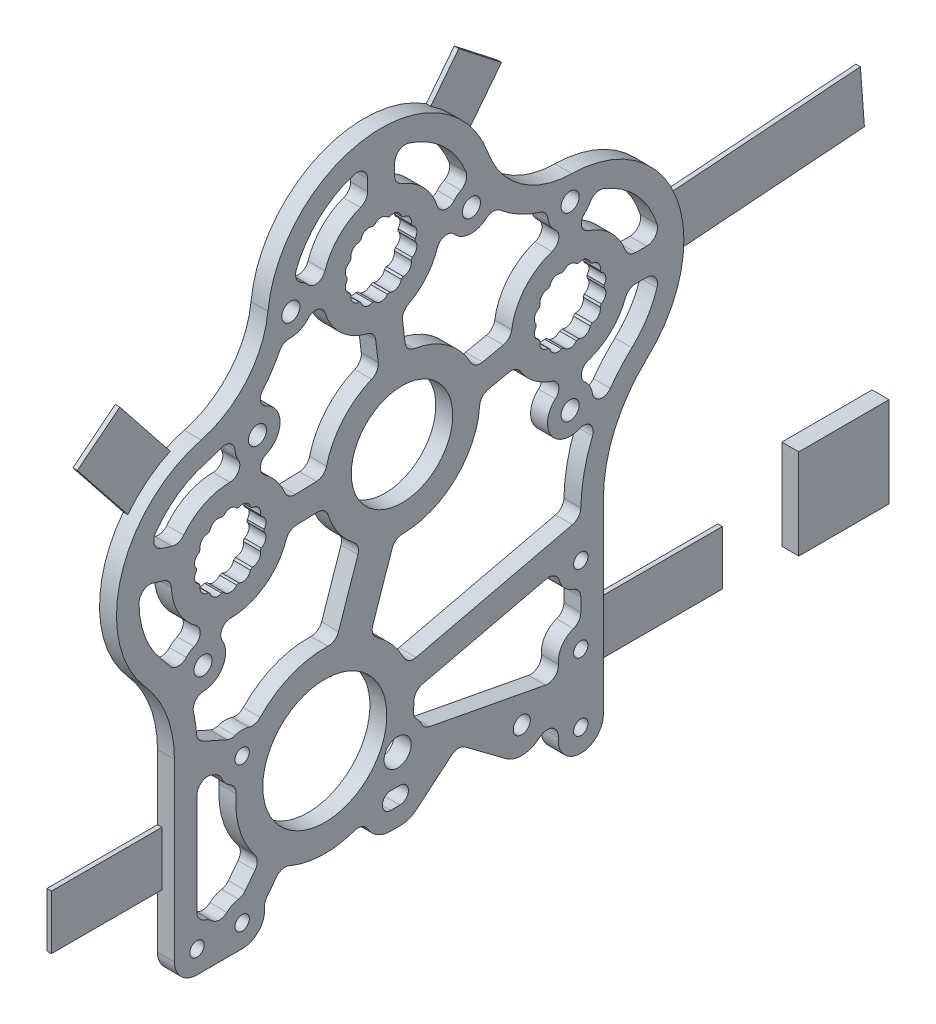
from build123d import *

# Parameters (mm, degrees)
SKETCH2_R                = 3.175
SKETCH2_R_2              = 9.5377
SKETCH2_R_3              = 2.5527
SKETCH2_R_4              = 14.26845
SKETCH2_R_5              = 17.44345
SKETCH2_R_6              = 2.4003
BOSS_EXTRUDE1_DEPTH      = 4.7625
F_10_32_TAPPED_HOLE1_D   = 4.0386
SKETCH29_R               = 2.25
CUT_EXTRUDE1_DEPTH       = 192.181527059
CIRPATTERN1_DEPTH        = 4.7625
CIRPATTERN2_DEPTH        = 4.7625
CIRPATTERN4_DEPTH        = 4.7625
SKETCH35_R               = 3.81
MAKE_SPENCER_HAPPY_DEPTH = 192.181527059
CUT_EXTRUDE2_DEPTH       = 192.181527059
FILLET2_R                = 3.048
SKETCH44_W               = 25.4
SKETCH44_H               = 25.4
BOSS_EXTRUDE7_DEPTH      = 4.7625
SKETCH45_W               = 36.971971767
SKETCH45_H               = 15.24
SKETCH45_W_2             = 31.086457688
BOSS_EXTRUDE10_DEPTH     = 1.27


# Read off the part's stored shape, not the designer's step: CirPattern1, CirPattern2, CirPattern4
with BuildPart() as part:
    # Sketch2 → Boss-Extrude1 (new body)
    with BuildSketch(Plane(origin=(0, 0, 0), x_dir=(0, 0, -1), z_dir=(1, 0, 0))):
        with BuildLine():
            Line((40.729215262, -8.89), (40.729215262, 43.636322391))
            ThreePointArc((40.729215262, 43.636322391), (43.941365421, 58.948015093), (53.036193395, 71.677899075))
            ThreePointArc((53.036193395, 71.677899075), (61.271533898, 106.641485869), (31.83945799, 127.233380936))
            ThreePointArc((31.83945799, 127.233380936), (17.465055653, 131.950038709), (8.322127102, 144.003136262))
            ThreePointArc((8.322127102, 144.003136262), (-25.669218461, 164.8991684), (-53.61396537, 136.41852844))
            ThreePointArc((-53.61396537, 136.41852844), (-59.578332083, 122.515412501), (-72.389860465, 114.469603429))
            ThreePointArc((-72.389860465, 114.469603429), (-94.839873152, 92.813821696), (-88.196021552, 62.337024161))
            ThreePointArc((-88.196021552, 62.337024161), (-82.058812, 52.162055891), (-79.920784738, 40.473422104))
            Line((-79.920784738, 40.473422104), (-79.920784738, -8.89))
            ThreePointArc((-79.920784738, -8.89), (-78.060912798, -13.380128061), (-73.570784738, -15.24))
            Line((-73.570784738, -15.24), (34.379215262, -15.24))
            ThreePointArc((34.379215262, -15.24), (38.869343323, -13.380128061), (40.729215262, -8.89))
        make_face()
        with Locations(Location((0, 0, 0), (0, 0, 180))):
            Circle(SKETCH2_R, mode=Mode.SUBTRACT)
        with Locations(Location((-64.212635695, 83.5279, 0), (0, 0, 180))):
            Circle(SKETCH2_R_2, mode=Mode.SUBTRACT)
        with Locations(Location((-21.77911278, 133.132470526, 0), (0, 0, 180))):
            Circle(SKETCH2_R_2, mode=Mode.SUBTRACT)
        with Locations(Location((31.370055026, 95.23282349, 0), (0, 0, 180))):
            Circle(SKETCH2_R_2, mode=Mode.SUBTRACT)
        with Locations(Location((-71.869528291, 59.309477348, 0), (0, 0, 180))):
            Circle(SKETCH2_R_3, mode=Mode.SUBTRACT)
        with Locations(Location((-56.555743099, 107.746322652, 0), (0, 0, 180))):
            Circle(SKETCH2_R_3, mode=Mode.SUBTRACT)
        with Locations(Location((3.62088722, 133.132470526, 0), (0, 0, 180))):
            Circle(SKETCH2_R_3, mode=Mode.SUBTRACT)
        with Locations(Location((-47.17911278, 133.132470526, 0), (0, 0, 180))):
            Circle(SKETCH2_R_3, mode=Mode.SUBTRACT)
        with Locations(Location((31.370055026, 120.63282349, 0), (0, 0, 180))):
            Circle(SKETCH2_R_3, mode=Mode.SUBTRACT)
        with Locations(Location((31.370055026, 69.83282349, 0), (0, 0, 180))):
            Circle(SKETCH2_R_3, mode=Mode.SUBTRACT)
        with Locations(Location((-15.903818249, 85.154672071, 0), (0, 0, 180))):
            Circle(SKETCH2_R_4, mode=Mode.SUBTRACT)
        with Locations(Location((-37.613686717, 21.3614, 0), (0, 0, 180))):
            Circle(SKETCH2_R_5, mode=Mode.SUBTRACT)
        with Locations(Location((17.78, 0, 0), (0, 0, 180))):
            Circle(SKETCH2_R_6, mode=Mode.SUBTRACT)
        with BuildLine():
            Line((-19.05, 2.4003), (-16.51, 2.4003))
            ThreePointArc((-16.51, 2.4003), (-14.1097, 0), (-16.51, -2.4003))
            Line((-16.51, -2.4003), (-19.05, -2.4003))
            ThreePointArc((-19.05, -2.4003), (-21.4503, 0), (-19.05, 2.4003))
        make_face(mode=Mode.SUBTRACT)
    extrude(amount=BOSS_EXTRUDE1_DEPTH)

    # #10-32 Tapped Hole1 (through all)
    with Locations(Plane(origin=(4.7625, 0, 0), x_dir=(0, 0, -1), z_dir=(1, 0, 0))):
        with Locations((-60.870784738, 31.75), (-60.870784738, -8.89), (34.379215262, -8.89), (34.379215262, 31.75), (34.379215262, 10.16), (-73.570784738, -8.89)):
            Hole(F_10_32_TAPPED_HOLE1_D / 2)

    # Sketch29 → Cut-Extrude1 (cut, through all)
    with BuildSketch(Plane(origin=(4.7625, 0, 0), x_dir=(0, 0, -1), z_dir=(1, 0, 0))):
        with Locations((31.370055026, 103.23382349)):
            Circle(SKETCH29_R)
        with Locations((-21.77911278, 141.133470526)):
            Circle(SKETCH29_R)
        with Locations((-64.212635695, 91.5289)):
            Circle(SKETCH29_R)
    extrude(amount=-CUT_EXTRUDE1_DEPTH, mode=Mode.SUBTRACT)

    # CirPattern1 outline → CirPattern1 (cut)
    with BuildSketch(Plane.YZ):
        with BuildLine():
            ThreePointArc((104.449018766, -33.825552109), (103.825994261, -35.508307965), (102.898812181, -37.044589252))
            ThreePointArc((102.898812181, -37.044589252), (104.468655355, -35.817797236), (104.449018766, -33.825552109))
        make_face()
        with BuildLine():
            ThreePointArc((104.449018766, -28.914557943), (104.468655355, -26.922312817), (102.898812181, -25.695520801))
            ThreePointArc((102.898812181, -25.695520801), (103.825994261, -27.231802088), (104.449018766, -28.914557943))
        make_face()
        with BuildLine():
            ThreePointArc((102.470928258, -25.158971333), (101.624217449, -23.3555005), (99.677552515, -22.931328512))
            ThreePointArc((99.677552515, -22.931328512), (101.179482173, -23.913180896), (102.470928258, -25.158971333))
        make_face()
        with BuildLine():
            ThreePointArc((99.059242332, -22.633566021), (97.513885584, -21.376068999), (95.575959754, -21.838529503))
            ThreePointArc((95.575959754, -21.838529503), (97.355161402, -22.071485078), (99.059242332, -22.633566021))
        make_face()
        with BuildLine():
            ThreePointArc((94.889687226, -21.838529503), (92.951761396, -21.376068999), (91.406404648, -22.633566021))
            ThreePointArc((91.406404648, -22.633566021), (93.110485578, -22.071485078), (94.889687226, -21.838529503))
        make_face()
        with BuildLine():
            ThreePointArc((90.788094465, -22.931328512), (88.841429531, -23.3555005), (87.994718722, -25.158971333))
            ThreePointArc((87.994718722, -25.158971333), (89.286164807, -23.913180896), (90.788094465, -22.931328512))
        make_face()
        with BuildLine():
            ThreePointArc((87.566834799, -25.695520801), (85.996991625, -26.922312817), (86.016628214, -28.914557943))
            ThreePointArc((86.016628214, -28.914557943), (86.639652719, -27.231802088), (87.566834799, -25.695520801))
        make_face()
        with BuildLine():
            ThreePointArc((85.86391821, -29.583624187), (84.98182349, -31.370055027), (85.86391821, -33.156485866))
            ThreePointArc((85.86391821, -33.156485866), (85.69512349, -31.370055027), (85.86391821, -29.583624187))
        make_face()
        with BuildLine():
            ThreePointArc((86.016628214, -33.825552109), (85.996991625, -35.817797236), (87.566834799, -37.044589252))
            ThreePointArc((87.566834799, -37.044589252), (86.639652718, -35.508307965), (86.016628214, -33.825552109))
        make_face()
        with BuildLine():
            ThreePointArc((87.994718722, -37.58113872), (88.841429531, -39.384609553), (90.788094465, -39.808781541))
            ThreePointArc((90.788094465, -39.808781541), (89.286164807, -38.826929157), (87.994718722, -37.58113872))
        make_face()
        with BuildLine():
            ThreePointArc((91.406404648, -40.106544032), (92.951761396, -41.364041054), (94.889687226, -40.901580549))
            ThreePointArc((94.889687226, -40.901580549), (93.110485578, -40.668624975), (91.406404648, -40.106544032))
        make_face()
        with BuildLine():
            ThreePointArc((95.575959754, -40.901580549), (97.513885584, -41.364041054), (99.059242332, -40.106544032))
            ThreePointArc((99.059242332, -40.106544032), (97.355161402, -40.668624975), (95.575959754, -40.901580549))
        make_face()
        with BuildLine():
            ThreePointArc((99.677552515, -39.808781541), (101.624217449, -39.384609553), (102.470928258, -37.58113872))
            ThreePointArc((102.470928258, -37.58113872), (101.179482173, -38.826929157), (99.677552515, -39.808781541))
        make_face()
    extrude(amount=CIRPATTERN1_DEPTH, mode=Mode.SUBTRACT)

    # CirPattern2 outline → CirPattern2 (cut)
    with BuildSketch(Plane.YZ):
        with BuildLine():
            ThreePointArc((142.348665802, 19.323615697), (141.725641297, 17.640859842), (140.798459217, 16.104578555))
            ThreePointArc((140.798459217, 16.104578555), (142.368302391, 17.331370571), (142.348665802, 19.323615697))
        make_face()
        with BuildLine():
            ThreePointArc((142.348665802, 24.234609863), (142.368302391, 26.22685499), (140.798459217, 27.453647006))
            ThreePointArc((140.798459217, 27.453647006), (141.725641297, 25.917365719), (142.348665802, 24.234609863))
        make_face()
        with BuildLine():
            ThreePointArc((140.370575294, 27.990196474), (139.523864485, 29.793667307), (137.577199551, 30.217839295))
            ThreePointArc((137.577199551, 30.217839295), (139.079129209, 29.235986911), (140.370575294, 27.990196474))
        make_face()
        with BuildLine():
            ThreePointArc((136.958889368, 30.515601786), (135.41353262, 31.773098808), (133.47560679, 31.310638303))
            ThreePointArc((133.47560679, 31.310638303), (135.254808438, 31.077682729), (136.958889368, 30.515601786))
        make_face()
        with BuildLine():
            ThreePointArc((132.789334262, 31.310638303), (130.851408432, 31.773098808), (129.306051684, 30.515601786))
            ThreePointArc((129.306051684, 30.515601786), (131.010132614, 31.077682729), (132.789334262, 31.310638303))
        make_face()
        with BuildLine():
            ThreePointArc((128.687741501, 30.217839295), (126.741076567, 29.793667307), (125.894365758, 27.990196474))
            ThreePointArc((125.894365758, 27.990196474), (127.185811843, 29.235986911), (128.687741501, 30.217839295))
        make_face()
        with BuildLine():
            ThreePointArc((125.466481835, 27.453647006), (123.896638661, 26.22685499), (123.91627525, 24.234609863))
            ThreePointArc((123.91627525, 24.234609863), (124.539299754, 25.917365719), (125.466481835, 27.453647006))
        make_face()
        with BuildLine():
            ThreePointArc((123.763565246, 23.56554362), (122.881470526, 21.779112781), (123.763565246, 19.992681941))
            ThreePointArc((123.763565246, 19.992681941), (123.594770526, 21.77911278), (123.763565246, 23.56554362))
        make_face()
        with BuildLine():
            ThreePointArc((123.91627525, 19.323615697), (123.896638661, 17.331370571), (125.466481835, 16.104578555))
            ThreePointArc((125.466481835, 16.104578555), (124.539299755, 17.640859842), (123.91627525, 19.323615697))
        make_face()
        with BuildLine():
            ThreePointArc((125.894365758, 15.568029087), (126.741076567, 13.764558254), (128.687741501, 13.340386266))
            ThreePointArc((128.687741501, 13.340386266), (127.185811843, 14.32223865), (125.894365758, 15.568029087))
        make_face()
        with BuildLine():
            ThreePointArc((129.306051684, 13.042623775), (130.851408432, 11.785126753), (132.789334262, 12.247587257))
            ThreePointArc((132.789334262, 12.247587257), (131.010132614, 12.480542832), (129.306051684, 13.042623775))
        make_face()
        with BuildLine():
            ThreePointArc((133.47560679, 12.247587257), (135.41353262, 11.785126753), (136.958889368, 13.042623775))
            ThreePointArc((136.958889368, 13.042623775), (135.254808438, 12.480542832), (133.47560679, 12.247587257))
        make_face()
        with BuildLine():
            ThreePointArc((137.577199551, 13.340386266), (139.523864485, 13.764558254), (140.370575294, 15.568029087))
            ThreePointArc((140.370575294, 15.568029087), (139.079129209, 14.32223865), (137.577199551, 13.340386266))
        make_face()
    extrude(amount=CIRPATTERN2_DEPTH, mode=Mode.SUBTRACT)

    # CirPattern4 outline → CirPattern4 (cut)
    with BuildSketch(Plane.YZ):
        with BuildLine():
            ThreePointArc((92.744095276, 61.757138612), (92.121070771, 60.074382756), (91.193888691, 58.538101469))
            ThreePointArc((91.193888691, 58.538101469), (92.763731865, 59.764893485), (92.744095276, 61.757138612))
        make_face()
        with BuildLine():
            ThreePointArc((92.744095276, 66.668132778), (92.763731865, 68.660377905), (91.193888691, 69.88716992))
            ThreePointArc((91.193888691, 69.88716992), (92.121070772, 68.350888633), (92.744095276, 66.668132778))
        make_face()
        with BuildLine():
            ThreePointArc((90.766004768, 70.423719389), (89.919293959, 72.227190222), (87.972629025, 72.651362209))
            ThreePointArc((87.972629025, 72.651362209), (89.474558683, 71.669509825), (90.766004768, 70.423719389))
        make_face()
        with BuildLine():
            ThreePointArc((87.354318842, 72.9491247), (85.808962094, 74.206621723), (83.871036264, 73.744161218))
            ThreePointArc((83.871036264, 73.744161218), (85.650237912, 73.511205643), (87.354318842, 72.9491247))
        make_face()
        with BuildLine():
            ThreePointArc((83.184763736, 73.744161218), (81.246837906, 74.206621723), (79.701481158, 72.9491247))
            ThreePointArc((79.701481158, 72.9491247), (81.405562088, 73.511205643), (83.184763736, 73.744161218))
        make_face()
        with BuildLine():
            ThreePointArc((79.083170975, 72.651362209), (77.136506041, 72.227190222), (76.289795232, 70.423719389))
            ThreePointArc((76.289795232, 70.423719389), (77.581241317, 71.669509825), (79.083170975, 72.651362209))
        make_face()
        with BuildLine():
            ThreePointArc((75.861911309, 69.88716992), (74.292068135, 68.660377905), (74.311704724, 66.668132778))
            ThreePointArc((74.311704724, 66.668132778), (74.934729229, 68.350888633), (75.861911309, 69.88716992))
        make_face()
        with BuildLine():
            ThreePointArc((74.15899472, 65.999066535), (73.2769, 64.212635695), (74.15899472, 62.426204855))
            ThreePointArc((74.15899472, 62.426204855), (73.9902, 64.212635695), (74.15899472, 65.999066535))
        make_face()
        with BuildLine():
            ThreePointArc((74.311704724, 61.757138612), (74.292068135, 59.764893485), (75.861911309, 58.538101469))
            ThreePointArc((75.861911309, 58.538101469), (74.934729229, 60.074382756), (74.311704724, 61.757138612))
        make_face()
        with BuildLine():
            ThreePointArc((76.289795232, 58.001552001), (77.136506041, 56.198081168), (79.083170975, 55.77390918))
            ThreePointArc((79.083170975, 55.77390918), (77.581241317, 56.755761564), (76.289795232, 58.001552001))
        make_face()
        with BuildLine():
            ThreePointArc((79.701481158, 55.47614669), (81.246837906, 54.218649667), (83.184763736, 54.681110172))
            ThreePointArc((83.184763736, 54.681110172), (81.405562088, 54.914065747), (79.701481158, 55.47614669))
        make_face()
        with BuildLine():
            ThreePointArc((83.871036264, 54.681110172), (85.808962094, 54.218649667), (87.354318842, 55.47614669))
            ThreePointArc((87.354318842, 55.47614669), (85.650237912, 54.914065747), (83.871036264, 54.681110172))
        make_face()
        with BuildLine():
            ThreePointArc((87.972629025, 55.77390918), (89.919293959, 56.198081168), (90.766004768, 58.001552001))
            ThreePointArc((90.766004768, 58.001552001), (89.474558683, 56.755761564), (87.972629025, 55.77390918))
        make_face()
    extrude(amount=CIRPATTERN4_DEPTH, mode=Mode.SUBTRACT)

    # Sketch35 → Make Spencer Happy (cut, through all)
    with BuildSketch(Plane(origin=(4.7625, 0, 0), x_dir=(0, 0, -1), z_dir=(1, 0, 0))):
        with Locations((-17.144999952, 10.792500132)):
            Circle(SKETCH35_R)
    extrude(amount=-MAKE_SPENCER_HAPPY_DEPTH, mode=Mode.SUBTRACT)

    # Sketch40 → Cut-Extrude2 (cut, through all)
    with BuildSketch(Plane(origin=(4.7625, 0, 0), x_dir=(0, 0, -1), z_dir=(1, 0, 0))):
        with BuildLine():
            Line((-67.062975965, 30.343135469), (-73.570784738, 33.250076918))
            Line((-73.570784738, 33.250076918), (-73.570784738, -2.54))
            ThreePointArc((-73.570784738, -2.54), (-69.080656677, -4.399871939), (-67.220784738, -8.89))
            ThreePointArc((-67.220784738, -8.89), (-65.334071764, -4.373190404), (-60.795093738, -2.540451128))
            Line((-60.795093738, -2.540451128), (-55.732691999, 4.044409109))
            ThreePointArc((-55.732691999, 4.044409109), (-61.579333514, 14.024895416), (-62.321608004, 25.567960543))
            ThreePointArc((-62.321608004, 25.567960543), (-65.376835284, 27.27585109), (-67.062975965, 30.343135469))
        make_face()
        with BuildLine():
            ThreePointArc((-76.227653005, 54.69111736), (-74.348438375, 48.25980138), (-73.586991616, 41.602964917))
            Line((-73.586991616, 41.602964917), (-63.955188231, 37.300581509))
            ThreePointArc((-63.955188231, 37.300581509), (-60.545571227, 38.091666671), (-57.2347648, 36.955944584))
            ThreePointArc((-57.2347648, 36.955944584), (-47.088262619, 44.565040606), (-34.515716105, 46.232650551))
            Line((-34.515716105, 46.232650551), (-27.572232938, 66.635699582))
            ThreePointArc((-27.572232938, 66.635699582), (-33.862365559, 72.640886796), (-37.317687621, 80.62141255))
            Line((-37.317687621, 80.62141255), (-47.935681795, 80.263857609))
            ThreePointArc((-47.935681795, 80.263857609), (-53.654277289, 70.717190856), (-64.117400458, 66.927173171))
            ThreePointArc((-64.117400458, 66.927173171), (-66.547036484, 65.484204558), (-66.474975361, 62.659298041))
            ThreePointArc((-66.474975361, 62.659298041), (-65.763059954, 61.051184684), (-65.519528291, 59.309477348))
            ThreePointArc((-65.519528291, 59.309477348), (-69.354731275, 53.478671574), (-76.227653005, 54.69111736))
        make_face()
        with BuildLine():
            ThreePointArc((-83.437413247, 66.541563018), (-80.605716799, 62.933170131), (-78.212922922, 59.019918099))
            ThreePointArc((-78.212922922, 59.019918099), (-77.245365994, 62.689250859), (-74.357963494, 65.151582297))
            ThreePointArc((-74.357963494, 65.151582297), (-72.6750777, 67.42164508), (-73.833631437, 69.999055189))
            ThreePointArc((-73.833631437, 69.999055189), (-79.239548476, 76.472044752), (-80.767404946, 84.765969487))
            Line((-80.767404946, 84.765969487), (-89.550512671, 87.542835408))
            ThreePointArc((-89.550512671, 87.542835408), (-88.844340978, 76.358045689), (-83.437413247, 66.541563018))
        make_face()
        with BuildLine():
            ThreePointArc((-70.767395233, 108.330376558), (-80.481797943, 103.363274354), (-87.253444893, 94.808362203))
            Line((-87.253444893, 94.808362203), (-78.470337167, 92.031496283))
            ThreePointArc((-78.470337167, 92.031496283), (-72.452331006, 97.939722306), (-64.307870932, 100.128626829))
            ThreePointArc((-64.307870932, 100.128626829), (-61.878234906, 101.571595442), (-61.950296029, 104.396501959))
            ThreePointArc((-61.950296029, 104.396501959), (-62.597336498, 105.791418769), (-62.89010649, 107.300968373))
            ThreePointArc((-62.89010649, 107.300968373), (-64.206805104, 109.480785473), (-66.745075243, 109.686898392))
            ThreePointArc((-66.745075243, 109.686898392), (-68.733539362, 108.941340309), (-70.767395233, 108.330376558))
        make_face()
        with BuildLine():
            Line((-48.192135616, 87.879540864), (-37.574141442, 88.237095805))
            ThreePointArc((-37.574141442, 88.237095805), (-32.536790486, 99.383111126), (-22.305507112, 106.086050981))
            Line((-22.305507112, 106.086050981), (-23.596862322, 116.631289126))
            ThreePointArc((-23.596862322, 116.631289126), (-32.272860498, 120.268782881), (-37.578884934, 128.037335504))
            ThreePointArc((-37.578884934, 128.037335504), (-39.687148156, 129.918961349), (-42.358920428, 128.998677391))
            ThreePointArc((-42.358920428, 128.998677391), (-45.603447845, 126.981065808), (-49.41840386, 127.190410659))
            ThreePointArc((-49.41840386, 127.190410659), (-51.856024084, 122.359709066), (-55.07850725, 118.013069848))
            ThreePointArc((-55.07850725, 118.013069848), (-55.708745297, 115.54566274), (-54.075366228, 113.591853474))
            ThreePointArc((-54.075366228, 113.591853474), (-51.26079772, 111.251469359), (-50.205743099, 107.746322652))
            ThreePointArc((-50.205743099, 107.746322652), (-51.258382268, 104.24482751), (-54.067307896, 101.904217703))
            ThreePointArc((-54.067307896, 101.904217703), (-55.75019369, 99.63415492), (-54.591639952, 97.056744811))
            ThreePointArc((-54.591639952, 97.056744811), (-50.59548309, 93.02349666), (-48.192135616, 87.879540864))
        make_face()
        with BuildLine():
            Line((-16.033362828, 117.557504764), (-14.742007618, 107.01226662))
            ThreePointArc((-14.742007618, 107.01226662), (-3.195638936, 102.976187774), (4.382381602, 93.375033317))
            Line((4.382381602, 93.375033317), (14.772901129, 95.590151771))
            ThreePointArc((14.772901129, 95.590151771), (18.056298313, 105.149329083), (26.274920004, 111.032595644))
            ThreePointArc((26.274920004, 111.032595644), (28.156545849, 113.140858866), (27.236261892, 115.812631137))
            ThreePointArc((27.236261892, 115.812631137), (25.399984586, 118.469317323), (25.107937246, 121.685620199))
            ThreePointArc((25.107937246, 121.685620199), (16.620439067, 124.972634959), (9.414247867, 130.532571989))
            ThreePointArc((9.414247867, 130.532571989), (4.529167073, 126.847764669), (-1.199305133, 128.998677391))
            ThreePointArc((-1.199305133, 128.998677391), (-3.871077405, 129.918961349), (-5.979340627, 128.037335504))
            ThreePointArc((-5.979340627, 128.037335504), (-9.799584668, 121.639685519), (-16.033362828, 117.557504764))
        make_face()
        with BuildLine():
            Line((-17.96911278, 158.501972216), (-17.96911278, 149.290350987))
            ThreePointArc((-17.96911278, 149.290350987), (-10.521587513, 145.333344505), (-5.979340627, 138.227605548))
            ThreePointArc((-5.979340627, 138.227605548), (-3.871077405, 136.345979703), (-1.199305133, 137.266263661))
            ThreePointArc((-1.199305133, 137.266263661), (0.830349523, 138.836451536), (3.31572139, 139.475133517))
            ThreePointArc((3.31572139, 139.475133517), (2.808778979, 140.650953756), (2.349658871, 141.84625814))
            ThreePointArc((2.349658871, 141.84625814), (-5.515750791, 152.972600888), (-17.96911278, 158.501972216))
        make_face()
        with BuildLine():
            ThreePointArc((36.465190049, 111.032595644), (43.570929006, 106.490348757), (47.527935488, 99.04282349))
            Line((47.527935488, 99.04282349), (56.739556716, 99.04282349))
            ThreePointArc((56.739556716, 99.04282349), (50.395319681, 112.442327284), (37.69718228, 120.09434349))
            ThreePointArc((37.69718228, 120.09434349), (37.021690101, 117.737737829), (35.503848161, 115.812631137))
            ThreePointArc((35.503848161, 115.812631137), (34.583564203, 113.140858866), (36.465190049, 111.032595644))
        make_face()
        with BuildLine():
            ThreePointArc((-37.578884934, 138.227605548), (-33.036638048, 145.333344505), (-25.58911278, 149.290350987))
            Line((-25.58911278, 149.290350987), (-25.58911278, 158.501972216))
            ThreePointArc((-25.58911278, 158.501972216), (-38.988616574, 152.157735181), (-46.64063278, 139.45959778))
            ThreePointArc((-46.64063278, 139.45959778), (-44.284027119, 138.7841056), (-42.358920428, 137.266263661))
            ThreePointArc((-42.358920428, 137.266263661), (-39.687148156, 136.345979703), (-37.578884934, 138.227605548))
        make_face()
        with BuildLine():
            Line((-17.953948419, 63.362443876), (-24.897431587, 42.959394846))
            ThreePointArc((-24.897431587, 42.959394846), (-18.622885598, 37.717622019), (-14.369206552, 30.735335553))
            Line((-14.369206552, 30.735335553), (34.379215262, 42.186550823))
            Line((34.379215262, 42.186550823), (34.379215262, 43.636322391))
            ThreePointArc((34.379215262, 43.636322391), (35.209740891, 52.18874635), (37.67028188, 60.42157493))
            ThreePointArc((37.67028188, 60.42157493), (37.028024246, 63.482613047), (33.948592456, 64.029923807))
            ThreePointArc((33.948592456, 64.029923807), (26.001887166, 66.440881005), (27.236261892, 74.653015843))
            ThreePointArc((27.236261892, 74.653015843), (28.156545849, 77.324788115), (26.274920004, 79.433051336))
            ThreePointArc((26.274920004, 79.433051336), (20.416508765, 82.758328498), (16.361679597, 88.137623142))
            Line((16.361679597, 88.137623142), (5.971160071, 85.922504687))
            ThreePointArc((5.971160071, 85.922504687), (5.981263572, 85.538647465), (5.984631751, 85.154672071))
            ThreePointArc((5.984631751, 85.154672071), (-1.168994333, 68.968591397), (-17.953948419, 63.362443876))
        make_face()
        with BuildLine():
            ThreePointArc((37.654401013, 70.743589937), (39.758664393, 68.42960531), (42.691054764, 69.517509686))
            ThreePointArc((42.691054764, 69.517509686), (45.538380112, 73.090062306), (48.737356417, 76.351495189))
            ThreePointArc((48.737356417, 76.351495189), (54.028272489, 83.202324854), (56.739556716, 91.42282349))
            Line((56.739556716, 91.42282349), (47.527935488, 91.42282349))
            ThreePointArc((47.527935488, 91.42282349), (43.570929006, 83.975298223), (36.465190049, 79.433051336))
            ThreePointArc((36.465190049, 79.433051336), (34.583564203, 77.324788115), (35.503848161, 74.653015843))
            ThreePointArc((35.503848161, 74.653015843), (36.933804519, 72.893410294), (37.654401013, 70.743589937))
        make_face()
        with BuildLine():
            Line((28.132714204, 32.891807572), (-12.626666755, 23.317252576))
            ThreePointArc((-12.626666755, 23.317252576), (-12.569351516, 22.340072679), (-12.550236717, 21.3614))
            ThreePointArc((-12.550236717, 21.3614), (-12.640446833, 19.23682579), (-12.910427799, 17.12754541))
            ThreePointArc((-12.910427799, 17.12754541), (-10.976172921, 15.26575097), (-9.807663732, 12.84868524))
            Line((-9.807663732, 12.84868524), (19.174541791, 7.349159223))
            Line((19.174541791, 7.349159223), (30.387606699, 5.221421148))
            ThreePointArc((30.387606699, 5.221421148), (28.39246006, 12.276899181), (34.379215262, 16.51))
            Line((34.379215262, 16.51), (34.379215262, 25.4))
            ThreePointArc((34.379215262, 25.4), (29.50207583, 27.683550571), (28.132714204, 32.891807572))
        make_face()
        with BuildLine():
            ThreePointArc((-54.754024341, -7.184789675), (-54.579364846, -8.029456137), (-54.520784738, -8.89))
            Line((-54.520784738, -8.89), (28.029215262, -8.89))
            ThreePointArc((28.029215262, -8.89), (28.037401177, -8.567673918), (28.061937815, -8.246178869))
            ThreePointArc((28.061937815, -8.246178869), (26.341412324, -5.093640224), (22.780742747, -5.563044137))
            ThreePointArc((22.780742747, -5.563044137), (18.115045147, -7.472792841), (13.297163071, -5.988243579))
            Line((13.297163071, -5.988243579), (1.902732143, 2.541699312))
            ThreePointArc((1.902732143, 2.541699312), (2.839172375, 1.421170371), (3.175, 0))
            ThreePointArc((3.175, 0), (-1.336926459, -2.879800799), (-2.049096154, 2.425248431))
            Line((-2.049096154, 2.425248431), (-11.682329462, -5.713885304))
            ThreePointArc((-11.682329462, -5.713885304), (-13.939658403, -7.024829689), (-16.51, -7.4803))
            Line((-16.51, -7.4803), (-19.05, -7.4803))
            ThreePointArc((-19.05, -7.4803), (-23.942853164, -5.658168962), (-26.451999896, -1.079483966))
            ThreePointArc((-26.451999896, -1.079483966), (-38.13076623, -3.696715545), (-49.691622601, -0.599929438))
            Line((-49.691622601, -0.599929438), (-54.754024341, -7.184789675))
        make_face()
        with BuildLine():
            ThreePointArc((-54.520784738, -8.89), (-56.380656677, -13.380128061), (-60.870784738, -15.24))
            Line((-60.870784738, -15.24), (34.379215262, -15.24))
            ThreePointArc((34.379215262, -15.24), (29.889087202, -13.380128061), (28.029215262, -8.89))
            Line((28.029215262, -8.89), (-54.520784738, -8.89))
        make_face()
    extrude(amount=-CUT_EXTRUDE2_DEPTH, mode=Mode.SUBTRACT)

    # Fillet2
    fillet2_edges = [part.edges().sort_by_distance(p)[0] for p in [
        (2.38125, -1.079483966, 26.451999896),
        (2.38125, -0.599929438, 49.691622601),
        (2.38125, -7.184789675, 54.754024341),
        (2.38125, 17.12754541, 12.910427799),
        (2.38125, 12.84868524, 9.807663732),
        (2.38125, 5.221421148, -30.387606699),
        (2.38125, 16.51, -34.379215262),
        (2.38125, 25.4, -34.379215262),
        (2.38125, 32.891807572, -28.132714204),
        (2.38125, 23.317252576, 12.626666755),
        (2.38125, 91.42282349, -56.739556716),
        (2.38125, 91.42282349, -47.527935488),
        (2.38125, 30.735335553, 14.369206552),
        (2.38125, 42.186550823, -34.379215262),
        (2.38125, 88.137623142, -16.361679597),
        (2.38125, 85.922504687, -5.971160071),
        (2.38125, 63.362443876, 17.953948419),
        (2.38125, 42.959394846, 24.897431587),
        (2.38125, 149.290350987, 25.58911278),
        (2.38125, 158.501972216, 25.58911278),
        (2.38125, 139.45959778, 46.64063278),
        (2.38125, 99.04282349, -47.527935488),
        (2.38125, 99.04282349, -56.739556716),
        (2.38125, 120.09434349, -37.69718228),
        (2.38125, 158.501972216, 17.96911278),
        (2.38125, 149.290350987, 17.96911278),
        (2.38125, 130.532571989, -9.414247867),
        (2.38125, 139.475133517, -3.31572139),
        (2.38125, 93.375033317, -4.382381602),
        (2.38125, 95.590151771, -14.772901129),
        (2.38125, 121.685620199, -25.107937246),
        (2.38125, 117.557504764, 16.033362828),
        (2.38125, 107.01226662, 14.742007618),
        (2.38125, 106.086050981, 22.305507112),
        (2.38125, 116.631289126, 23.596862322),
        (2.38125, 127.190410659, 49.41840386),
        (2.38125, 87.879540864, 48.192135616),
        (2.38125, 88.237095805, 37.574141442),
        (2.38125, 94.808362203, 87.253444893),
        (2.38125, 92.031496283, 78.470337167),
        (2.38125, 84.765969487, 80.767404946),
        (2.38125, 87.542835408, 89.550512671),
        (2.38125, 54.69111736, 76.227653005),
        (2.38125, 59.019918099, 78.212922922),
        (2.38125, 46.232650551, 34.515716105),
        (2.38125, 66.635699582, 27.572232938),
        (2.38125, 80.62141255, 37.317687621),
        (2.38125, 80.263857609, 47.935681795),
        (2.38125, 41.602964917, 73.586991616),
        (2.38125, 37.300581509, 63.955188231),
        (2.38125, 36.955944584, 57.2347648),
        (2.38125, 25.567960543, 62.321608004),
        (2.38125, 30.343135469, 67.062975965),
        (2.38125, 33.250076918, 73.570784738),
        (2.38125, -2.54, 73.570784738),
        (2.38125, -8.89, 67.220784738),
        (2.38125, -2.540451128, 60.795093738),
        (2.38125, 4.044409109, 55.732691999),
    ]]
    fillet(fillet2_edges, radius=FILLET2_R)

    # Sketch45 → Boss-Extrude10 (add)
    with BuildSketch(Plane.ZY):
        with Locations((-59.215201146, 8.985640976)):
            Rectangle(SKETCH45_W, SKETCH45_H)
        with Locations((95.464013582, 14.531329199)):
            Rectangle(SKETCH45_W_2, SKETCH45_H)
        Polygon((77.599296823, 112.597700822), (89.526204328, 103.11052646), (103.721684186, 120.956532952), (91.794776682, 130.443707314), align=None)
        Polygon((-62.93219586, 89.93307991), (-61.804832585, 105.131324941), (-116.506177526, 109.188917594), (-117.633540801, 93.990672563), align=None)
        Polygon((-6.191359158, 148.685885442), (5.822445978, 158.062776512), (-3.554445092, 170.076581648), (-15.568250229, 160.699690578), align=None)
    extrude(amount=-BOSS_EXTRUDE10_DEPTH)


with BuildPart() as body_2:
    # Sketch44 → Boss-Extrude7 (new body)
    with BuildSketch(Plane(origin=(4.7625, 0, 0), x_dir=(0, 0, -1), z_dir=(1, 0, 0))):
        with Locations((108.37568444, 14.85015134)):
            Rectangle(SKETCH44_W, SKETCH44_H)
    extrude(amount=-BOSS_EXTRUDE7_DEPTH)


solid = Compound([part.part, body_2.part])
